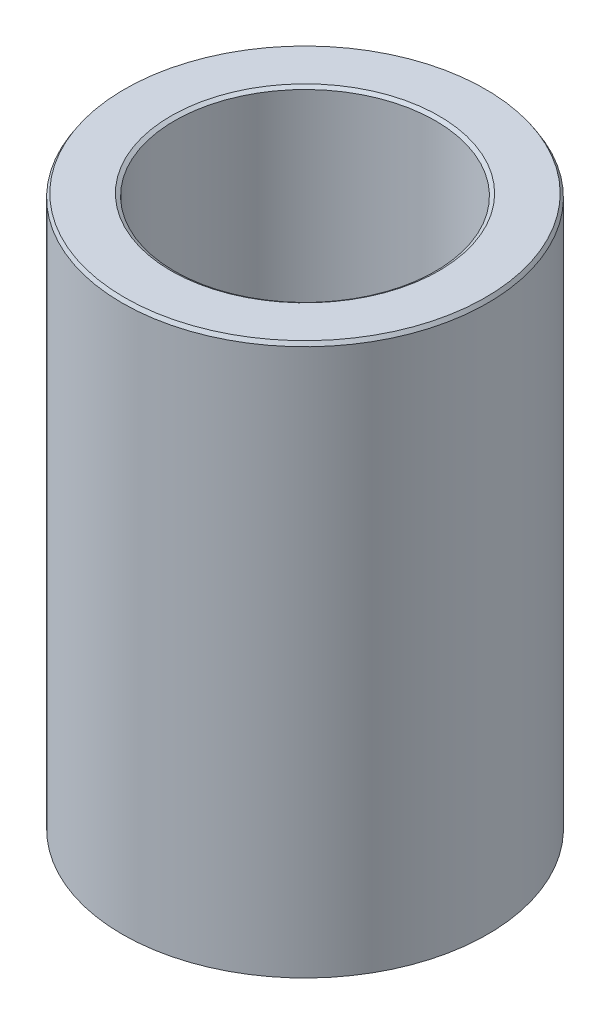
from build123d import *
from OCP.BRepFilletAPI import BRepFilletAPI_MakeChamfer

# Parameters (mm, degrees)
SKETCH1_R           = 35
BOSS_EXTRUDE1_DEPTH = 105.834409901
SKETCH2_R           = 24.97980738
CUT_EXTRUDE1_DEPTH  = 117.83716155
CHAMFER1_SIZE       = 0.701064838
CHAMFER1_SIZE2      = 0.440018491


with BuildPart() as part:
    # Sketch1 → Boss-Extrude1 (new body)
    with BuildSketch(Plane(origin=(0, 0, 0), x_dir=(1, 0, 0), z_dir=(0, 1, 0))):
        Circle(SKETCH1_R)
    extrude(amount=BOSS_EXTRUDE1_DEPTH)

    # Sketch2 → Cut-Extrude1 (cut, through all)
    with BuildSketch(Plane(origin=(0, 0, 0), x_dir=(1, 0, 0), z_dir=(0, 1, 0))):
        Circle(SKETCH2_R)
    extrude(amount=CUT_EXTRUDE1_DEPTH, mode=Mode.SUBTRACT)

    # Chamfer1: one chamfer whose edges measure the first distance from different faces: ONE call of the kernel's chamfer builder (chamfer() names one face for all edges)
    chamfer1_edges_1 = [part.edges().sort_by_distance(p)[0] for p in [
        (-24.97980738, 105.834409901, 0),
    ]]
    chamfer1_side_1 = [part.faces().sort_by_distance(p)[0] for p in [
        (-34.010050506, 105.834409901, 0),
    ]]
    chamfer1_edges_2 = [part.edges().sort_by_distance(p)[0] for p in [
        (-24.97980738, 0, 0),
    ]]
    chamfer1_side_2 = [part.faces().sort_by_distance(p)[0] for p in [
        (-24.97980738, 52.917204951, 0),
    ]]
    chamfer1_edges_3 = [part.edges().sort_by_distance(p)[0] for p in [
        (-35, 0, 0),
    ]]
    chamfer1_side_3 = [part.faces().sort_by_distance(p)[0] for p in [
        (-34.010050506, 0, 0),
    ]]
    chamfer1_edges_4 = [part.edges().sort_by_distance(p)[0] for p in [
        (-35, 105.834409901, 0),
    ]]
    chamfer1_side_4 = [part.faces().sort_by_distance(p)[0] for p in [
        (-35, 52.917204951, 0),
    ]]
    chamfer1 = BRepFilletAPI_MakeChamfer(part.part.solid().wrapped)
    for e in chamfer1_edges_1:
        chamfer1.Add(CHAMFER1_SIZE, CHAMFER1_SIZE2, e.wrapped, chamfer1_side_1[0].wrapped)  # the first distance lies on this face
    for e in chamfer1_edges_2:
        chamfer1.Add(CHAMFER1_SIZE, CHAMFER1_SIZE2, e.wrapped, chamfer1_side_2[0].wrapped)  # the first distance lies on this face
    for e in chamfer1_edges_3:
        chamfer1.Add(CHAMFER1_SIZE, CHAMFER1_SIZE2, e.wrapped, chamfer1_side_3[0].wrapped)  # the first distance lies on this face
    for e in chamfer1_edges_4:
        chamfer1.Add(CHAMFER1_SIZE, CHAMFER1_SIZE2, e.wrapped, chamfer1_side_4[0].wrapped)  # the first distance lies on this face
    add(Compound.cast(chamfer1.Shape()), mode=Mode.REPLACE)


solid = part.part
